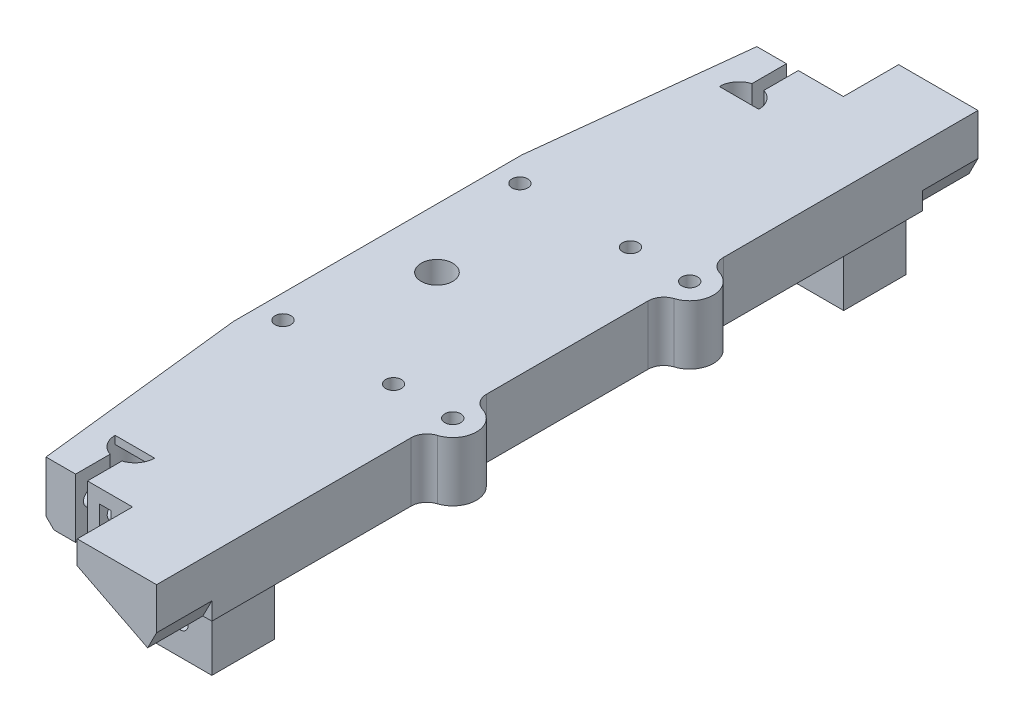
from build123d import *

# Parameters (mm, degrees)
SZKIC1_R                    = 4
SZKIC1_R_2                  = 2
DODANIE_WYCI_GNI_CIE1_DEPTH = 15
SZKIC2_W                    = 15.8
SZKIC2_H                    = 15.8
DODANIE_WYCI_GNI_CIE2_DEPTH = 14
DODANIE_WYCI_GNI_CIE3_START = -2
DODANIE_WYCI_GNI_CIE3_DEPTH = 2
DODANIE_WYCI_GNI_CIE4_DEPTH = 15
SZKIC5_R                    = 2
WYTNIJ_WYCI_GNI_CIE1_DEPTH  = 15
ZAOKR_GLENIE1_R             = 4
SFAZOWANIE1_SIZE            = 2
SZKIC6_R                    = 2
WYTNIJ_WYCI_GNI_CIE2_DEPTH  = 182.834155207
WYTNIJ_WYCI_GNI_CIE3_START  = -7
SZKIC8_R                    = 2
WYTNIJ_WYCI_GNI_CIE3_DEPTH  = 107.031560626
WYTNIJ_WYCI_GNI_CIE4_START  = 8
SZKIC9_R                    = 3.5
WYTNIJ_WYCI_GNI_CIE4_DEPTH  = 4
WYTNIJ_WYCI_GNI_CIE5_START  = -6
SZKIC10_R                   = 2
WYTNIJ_WYCI_GNI_CIE5_DEPTH  = 3
DODANIE_WYCI_GNI_CIE5_DEPTH = 14
SZKIC12_W                   = 10.2
SZKIC12_H                   = 10.2
WYTNIJ_WYCI_GNI_CIE6_DEPTH  = 5


with BuildPart() as part:
    # Szkic1 → Dodanie-wyciągnięcie1 (new body)
    with BuildSketch(Plane(origin=(0, 0, 0), x_dir=(1, 0, 0), z_dir=(0, 1, 0))):
        with BuildLine():
            Line((-14.5, 90), (-20.5, 36.5))
            Line((-20.5, 36.5), (-20.5, -36.5))
            Line((-20.5, -36.5), (-14.5, -90))
            Line((-14.5, -90), (-7, -90))
            Line((-7, -90), (-7, -81.269696007))
            ThreePointArc((-7, -81.269696007), (-5.5, -71.5), (-4, -81.269696007))
            Line((-4, -81.269696007), (-4, -90))
            Line((-4, -90), (27.5, -90))
            Line((27.5, -90), (27.5, 90))
            Line((27.5, 90), (-3.999999732, 90))
            Line((-3.999999732, 90), (-4, 81.269696007))
            ThreePointArc((-4, 81.269696007), (-5.5, 71.5), (-7, 81.269696007))
            Line((-7, 81.269696007), (-6.999999732, 90))
            Line((-6.999999732, 90), (-14.5, 90))
        make_face()
        with Locations((-5.5, 0)):
            Circle(SZKIC1_R, mode=Mode.SUBTRACT)
        with Locations((-14.5, 30)):
            Circle(SZKIC1_R_2, mode=Mode.SUBTRACT)
        with Locations((13.5, 30)):
            Circle(SZKIC1_R_2, mode=Mode.SUBTRACT)
        with Locations((-14.5, -30)):
            Circle(SZKIC1_R_2, mode=Mode.SUBTRACT)
        with Locations((13.5, -30)):
            Circle(SZKIC1_R_2, mode=Mode.SUBTRACT)
    extrude(amount=DODANIE_WYCI_GNI_CIE1_DEPTH)

    # Szkic2 → Dodanie-wyciągnięcie2 (add)
    with BuildSketch(Plane.XZ):
        with Locations((17.5, -80)):
            Rectangle(SZKIC2_W, SZKIC2_H)
    dodanie_wyci_gni_cie2 = extrude(amount=DODANIE_WYCI_GNI_CIE2_DEPTH)

    # Lustro1: Dodanie-wyciągnięcie2 across plane
    add(dodanie_wyci_gni_cie2.mirror(Plane.XY))

    # Szkic3 → Dodanie-wyciągnięcie3 (add)
    with BuildSketch(Plane(origin=(0, 15, 0), x_dir=(1, 0, 0), z_dir=(0, 1, 0)).offset(DODANIE_WYCI_GNI_CIE3_START)):
        with BuildLine():
            Line((-0.5, 76.5), (-10.5, 76.5))
            ThreePointArc((-10.5, 76.5), (-5.5, 71.5), (-0.5, 76.5))
        make_face()
        with BuildLine():
            ThreePointArc((-0.5, -76.5), (-5.5, -71.5), (-10.5, -76.5))
            Line((-10.5, -76.5), (-0.5, -76.5))
        make_face()
    extrude(amount=DODANIE_WYCI_GNI_CIE3_DEPTH)

    # Szkic4 → Dodanie-wyciągnięcie4 (add)
    with BuildSketch(Plane(origin=(0, 15, 0), x_dir=(1, 0, 0), z_dir=(0, 1, 0))):
        with BuildLine():
            ThreePointArc((27.5, -28.267949192), (30.5, -30), (27.5, -31.732050808))
            Line((27.5, -31.732050808), (27.5, -35.916079783))
            ThreePointArc((27.5, -35.916079783), (34.5, -30), (27.5, -24.083920217))
            Line((27.5, -24.083920217), (27.5, -28.267949192))
        make_face()
        with BuildLine():
            Line((27.5, 28.267949192), (27.5, 24.083920217))
            ThreePointArc((27.5, 24.083920217), (34.5, 30), (27.5, 35.916079783))
            Line((27.5, 35.916079783), (27.5, 31.732050808))
            ThreePointArc((27.5, 31.732050808), (30.5, 30), (27.5, 28.267949192))
        make_face()
    extrude(amount=-DODANIE_WYCI_GNI_CIE4_DEPTH)

    # Szkic5 → Wytnij-wyciągnięcie1 (cut)
    with BuildSketch(Plane(origin=(0, 15, 0), x_dir=(1, 0, 0), z_dir=(0, 1, 0))):
        with Locations((28.5, 30)):
            Circle(SZKIC5_R)
        with Locations((28.5, -30)):
            Circle(SZKIC5_R)
    extrude(amount=-WYTNIJ_WYCI_GNI_CIE1_DEPTH, mode=Mode.SUBTRACT)

    # Zaokrąglenie1
    zaokr_glenie1_edges = [part.edges().sort_by_distance(p)[0] for p in [
        (27.5, 7.5, -35.916079783),
        (27.5, 7.5, -24.083920217),
        (27.5, 7.5, 24.083920217),
        (27.5, 7.5, 35.916079783),
    ]]
    fillet(zaokr_glenie1_edges, radius=ZAOKR_GLENIE1_R)

    # Sfazowanie1
    sfazowanie1_edges = [part.edges().sort_by_distance(p)[0] for p in [
        (-17.5, 0, -63.25),
        (-17.5, 0, 63.25),
        (-20.5, 0, 0),
    ]]
    chamfer(sfazowanie1_edges, length=SFAZOWANIE1_SIZE)

    # Szkic6 → Wytnij-wyciągnięcie2 (cut, through all)
    with BuildSketch(Plane.XY.offset(87.9)):
        with Locations((17.4, -6)):
            Circle(SZKIC6_R)
    extrude(amount=-WYTNIJ_WYCI_GNI_CIE2_DEPTH, mode=Mode.SUBTRACT)

    # Szkic8 → Wytnij-wyciągnięcie3 (cut)
    with BuildSketch(Plane.ZY.offset(4).offset(WYTNIJ_WYCI_GNI_CIE3_START)):
        with Locations((86, 8)):
            Circle(SZKIC8_R)
    wytnij_wyci_gni_cie3 = extrude(amount=WYTNIJ_WYCI_GNI_CIE3_DEPTH, mode=Mode.SUBTRACT)

    # Szkic9 → Wytnij-wyciągnięcie4 (cut)
    with BuildSketch(Plane.ZY.offset(4).offset(WYTNIJ_WYCI_GNI_CIE4_START)):
        with Locations((86, 8)):
            Circle(SZKIC9_R)
    wytnij_wyci_gni_cie4 = extrude(amount=WYTNIJ_WYCI_GNI_CIE4_DEPTH, mode=Mode.SUBTRACT)

    # Szkic10 → Wytnij-wyciągnięcie5 (cut)
    with BuildSketch(Plane.ZY.offset(4).offset(WYTNIJ_WYCI_GNI_CIE5_START)):
        Polygon((83, 6.267949192), (86, 4.535898385), (90, 4.535898385), (90, 11.464101615), (86, 11.464101615), (83, 9.732050808), align=None)
        with Locations((86, 8)):
            Circle(SZKIC10_R, mode=Mode.SUBTRACT)
    wytnij_wyci_gni_cie5 = extrude(amount=WYTNIJ_WYCI_GNI_CIE5_DEPTH, mode=Mode.SUBTRACT)

    # Lustro2: Wytnij-wyciągnięcie3, Wytnij-wyciągnięcie4, Wytnij-wyciągnięcie5 across plane
    add(wytnij_wyci_gni_cie3.mirror(Plane.XY), mode=Mode.SUBTRACT)
    add(wytnij_wyci_gni_cie4.mirror(Plane.XY), mode=Mode.SUBTRACT)
    add(wytnij_wyci_gni_cie5.mirror(Plane.XY), mode=Mode.SUBTRACT)

    # Szkic11 → Dodanie-wyciągnięcie5 (add)
    with BuildSketch(Plane.XY.offset(90)):
        Polygon((7.409917018, 9.079809995), (25.230047501, 0), (27.5, 4.455032621), (27.5, 15), (7.409917018, 15), align=None)
    dodanie_wyci_gni_cie5 = extrude(amount=DODANIE_WYCI_GNI_CIE5_DEPTH)

    # Szkic12 → Wytnij-wyciągnięcie6 (cut)
    with BuildSketch(Plane(origin=(5.200098833, 10.205768599, 0), x_dir=(0.8910065241883673, -0.4539904997395478, 0), z_dir=(-0.4539904997395478, -0.8910065241883673, 0))):
        with Locations((11.880136929, 96.1)):
            Rectangle(SZKIC12_W, SZKIC12_H)
    wytnij_wyci_gni_cie6 = extrude(amount=-WYTNIJ_WYCI_GNI_CIE6_DEPTH, mode=Mode.SUBTRACT)

    # Lustro3: Dodanie-wyciągnięcie5, Wytnij-wyciągnięcie6 across plane
    add(dodanie_wyci_gni_cie5.mirror(Plane.XY))
    add(wytnij_wyci_gni_cie6.mirror(Plane.XY), mode=Mode.SUBTRACT)


solid = part.part
